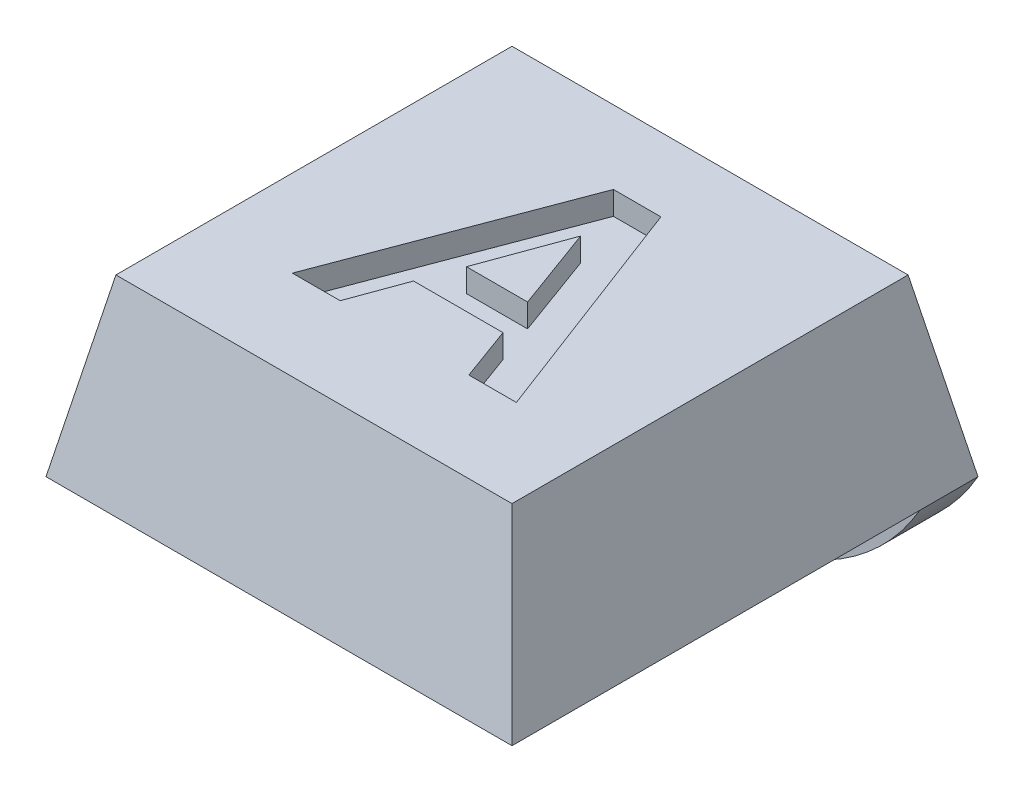
from build123d import *

# Parameters (mm, degrees)
SKETCH1_W               = 8
SKETCH1_H               = 8
BOSS_EXTRUDE1_DEPTH     = 3
CUT_EXTRUDE1_DEPTH      = 12.704699911
CUT_EXTRUDE1_DEPTH_BACK = 12.704699911
CUT_EXTRUDE2_DEPTH      = 11
SKETCH4_R               = 1.8
CUT_EXTRUDE3_DEPTH      = 0.8
SKETCH5_W               = 8
SKETCH5_H               = 1
BOSS_EXTRUDE2_DEPTH     = 2
FILLET1_R               = 4
CUT_EXTRUDE4_DEPTH      = 0.4


with BuildPart() as part:
    # Sketch1 → Boss-Extrude1 (new body)
    with BuildSketch(Plane(origin=(0, 0, 0), x_dir=(1, 0, 0), z_dir=(0, 1, 0))):
        with Locations((4, 4)):
            Rectangle(SKETCH1_W, SKETCH1_H)
    extrude(amount=BOSS_EXTRUDE1_DEPTH)

    # Sketch2 → Cut-Extrude1 (cut, two sides: drawn at the far end of the back side and taken through both)
    with BuildSketch(Plane.XY.offset(-CUT_EXTRUDE1_DEPTH_BACK)):
        Polygon((0, 0), (0.6, 3), (0, 3), align=None)
        Polygon((8, 0), (7.4, 3), (8, 3), align=None)
    extrude(amount=CUT_EXTRUDE1_DEPTH + CUT_EXTRUDE1_DEPTH_BACK, mode=Mode.SUBTRACT)

    # Sketch3 → Cut-Extrude2 (cut)
    with BuildSketch(Plane(origin=(0, 0, 0), x_dir=(0, 0, -1), z_dir=(1, 0, 0))):
        Polygon((0, 0), (0.6, 3), (0, 3), align=None)
        Polygon((8, 3), (7.4, 3), (8, 0), align=None)
    extrude(amount=CUT_EXTRUDE2_DEPTH, mode=Mode.SUBTRACT)

    # Sketch4 → Cut-Extrude3 (cut)
    with BuildSketch(Plane.XZ):
        with Locations(Location((4, -3.75, 0), (0, 0, 270))):
            Circle(SKETCH4_R)
    extrude(amount=-CUT_EXTRUDE3_DEPTH, mode=Mode.SUBTRACT)

    # Sketch5 → Boss-Extrude2 (add)
    with BuildSketch(Plane.XZ):
        with Locations((4, -7.5)):
            Rectangle(SKETCH5_W, SKETCH5_H)
    extrude(amount=BOSS_EXTRUDE2_DEPTH)

    # Fillet1
    # the kernel refuses this fillet: 4 mm, written as the material it takes off along each edge
    with BuildSketch(Plane(origin=(8, -2, -16.660254038), x_dir=(0, 1, 0), z_dir=(0, 0, 1)), Plane(origin=(0, -2, 1.660254038), x_dir=(0, 1, 0), z_dir=(0, 0, -1))) as fillet1_piece_1:
        with BuildLine():
            CenterArc((4, 3.464101615), FILLET1_R, 180, 60)
            Line((0, 3.464101615), (-0.08, 3.464101615))
            Line((-0.08, 3.464101615), (-0.08, 0))
            Line((-0.08, 0), (0, -0.08))
            ThreePointArc((0, -0.08), (1, -0.08), (1.96, -0.069282032))
            Line((1.96, -0.069282032), (2, 0))
        make_face()
    extrude(amount=18.320508076, mode=Mode.SUBTRACT)

    # Sketch6 → Cut-Extrude4 (cut)
    with BuildSketch(Plane(origin=(0, 3, 0), x_dir=(1, 0, 0), z_dir=(0, 1, 0))):
        Polygon((5.933857302, 2.141652068), (5.118152174, 2.141652068), (4.780812431, 3.064728992), (3.24555602, 3.064728992), (2.908216277, 2.141652068), (2.087703456, 2.141652068), (3.599722687, 6.141652068), (4.414626533, 6.141652068), align=None)
        Polygon((4.536421405, 3.731395658), (4.010780379, 5.167293094), (3.486741918, 3.731395658), align=None, mode=Mode.SUBTRACT)
    extrude(amount=-CUT_EXTRUDE4_DEPTH, mode=Mode.SUBTRACT)


solid = part.part
